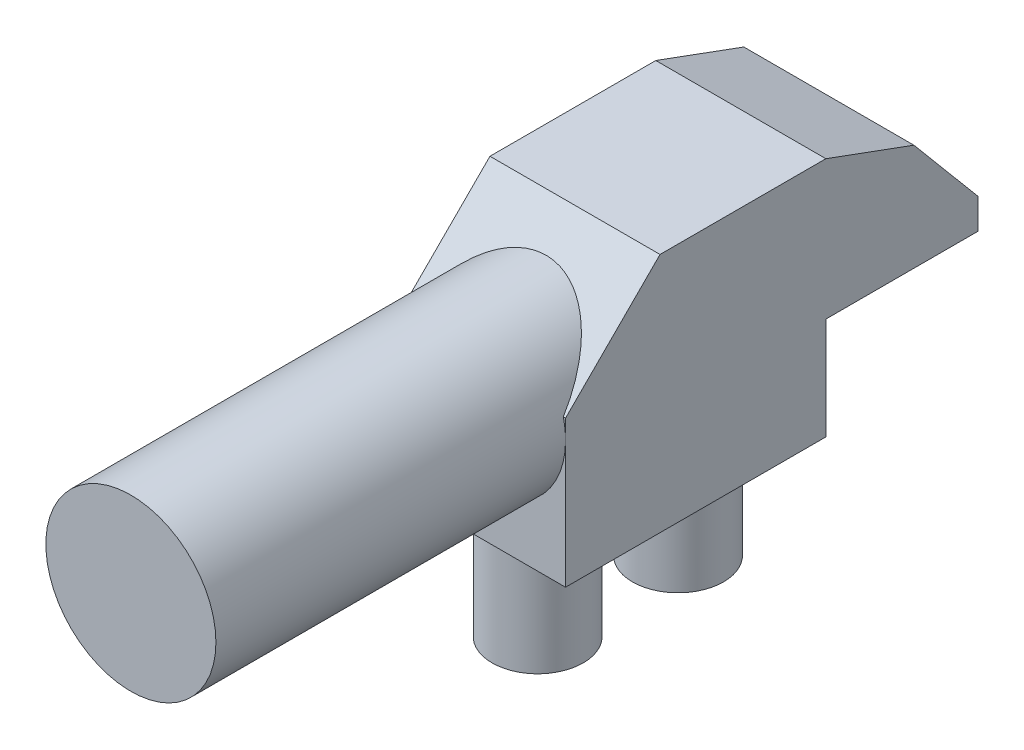
from build123d import *

# Parameters (mm, degrees)
BOSS_EXTRUDE1_DEPTH             = 2.41
BOSS_EXTRUDE1_DEPTH_BACK        = 2.69
SKETCH1_W                       = 3.6
SKETCH1_H                       = 5.51
SKETCH2_R                       = 1.8
BOSS_EXTRUDE2_DEPTH             = 7.4
SKETCH3_R                       = 0.965
BOSS_EXTRUDE3_DEPTH             = 2.41
BOSS_EXTRUDE4_REACH             = 13.505
BOSS_EXTRUDE4_DIRECTION_2_REACH = 13.505
CHAMFER1_SIZE                   = 2


with BuildPart() as part:
    # Sketch1 → Boss-Extrude1 (new, two sides: drawn at the far end of the back side and taken through both)
    with BuildSketch(Plane(origin=(0, 0, 0), x_dir=(1, 0, 0), z_dir=(0, 1, 0)).offset(-BOSS_EXTRUDE1_DEPTH_BACK)):
        Rectangle(SKETCH1_W, SKETCH1_H)
    extrude(amount=BOSS_EXTRUDE1_DEPTH + BOSS_EXTRUDE1_DEPTH_BACK)

    # Sketch2 → Boss-Extrude2 (add)
    with BuildSketch(Plane.XY.offset(2.755)):
        Circle(SKETCH2_R)
    extrude(amount=BOSS_EXTRUDE2_DEPTH)

    # Sketch3 → Boss-Extrude3 (add)
    with BuildSketch(Plane.XZ.offset(2.69)):
        with Locations(Location((0, 1.545, 0), (0, 0, 90))):
            Circle(SKETCH3_R)
        with Locations(Location((0, -1.425, 0), (0, 0, 90))):
            Circle(SKETCH3_R)
    extrude(amount=BOSS_EXTRUDE3_DEPTH)

    # Boss-Extrude4: up to this face of the body (flat: up to its plane)
    boss_extrude4_end = Plane(part.part.faces().sort_by_distance((1.8, -0.14, 0))[0])
    # Sketch4 → Boss-Extrude4 (add, up to the picked face)
    with BuildSketch(Plane(origin=(0, 0, 0), x_dir=(0, 0, -1), z_dir=(1, 0, 0)), mode=Mode.PRIVATE) as boss_extrude4_sk1:
        Polygon((2.755, -0.53), (5.975, -0.53), (5.975, 0.110868038), (4.618427758, 1.726276708), (2.755, 2.41), align=None)
    boss_extrude4_tool1 = split(extrude(boss_extrude4_sk1.sketch, amount=BOSS_EXTRUDE4_REACH, mode=Mode.PRIVATE), bisect_by=boss_extrude4_end, keep=Keep.BOTH, mode=Mode.PRIVATE)
    add(boss_extrude4_tool1.solids().sort_by(Axis((0, 0.630129, -4.086068), (1, 0, 0)))[0])

    # Boss-Extrude4 direction 2: up to this face of the body (flat: up to its plane)
    boss_extrude4_direction_2_end = Plane(part.part.faces().sort_by_distance((-1.8, -0.14, 0))[0])
    # Sketch4 → Boss-Extrude4 direction 2 (add, up to the picked face)
    with BuildSketch(Plane(origin=(0, 0, 0), x_dir=(0, 0, -1), z_dir=(1, 0, 0)), mode=Mode.PRIVATE) as boss_extrude4_direction_2_sk1:
        Polygon((2.755, -0.53), (5.975, -0.53), (5.975, 0.110868038), (4.618427758, 1.726276708), (2.755, 2.41), align=None)
    boss_extrude4_direction_2_tool1 = split(extrude(boss_extrude4_direction_2_sk1.sketch, amount=-BOSS_EXTRUDE4_DIRECTION_2_REACH, mode=Mode.PRIVATE), bisect_by=boss_extrude4_direction_2_end, keep=Keep.BOTH, mode=Mode.PRIVATE)
    add(boss_extrude4_direction_2_tool1.solids().sort_by(Axis((0, 0.630129, -4.086068), (-1, 0, 0)))[0])

    # Chamfer1
    # the kernel refuses this chamfer: 2 mm, written as the material it takes off along each edge
    with BuildSketch(Plane(origin=(6.943365976, 2.41, 2.755), x_dir=(0, -0.9996219169112968, 0.02749587661058627), z_dir=(-1, 0, 0))) as chamfer1_piece_1_section:
        Polygon((CHAMFER1_SIZE * 0.999621916911, -CHAMFER1_SIZE * 0.0274958766106), (-CHAMFER1_SIZE * 0.0274958766106, -CHAMFER1_SIZE * 0.999621916911), (0, 0), align=None)
    chamfer1_piece_1 = extrude(amount=13.886731952, mode=Mode.PRIVATE)
    chamfer1_piece_1 = chamfer1_piece_1 - Plane(origin=(0, 0, 2.480910963), x_dir=(1, 0, 0), z_dir=(0, 0, -1)) * Cylinder(1.8, 36, mode=Mode.PRIVATE)
    add(chamfer1_piece_1, mode=Mode.SUBTRACT)


solid = part.part
